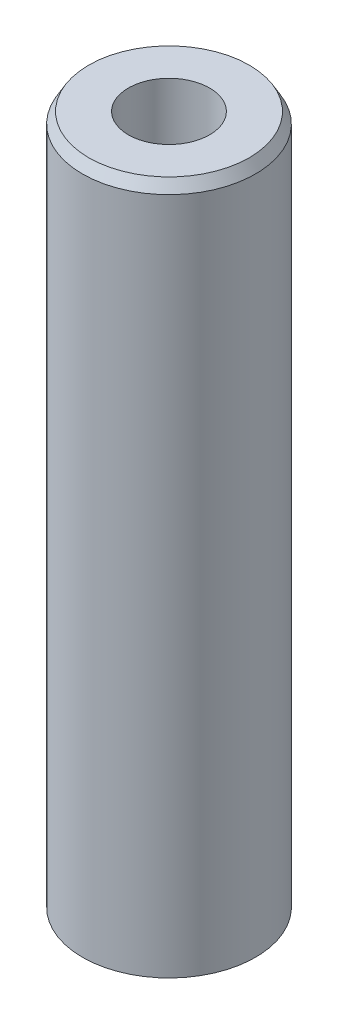
from build123d import *
from OCP.BRepFilletAPI import BRepFilletAPI_MakeChamfer

# Parameters (mm, degrees)
SKETCH1_R           = 12.5
BOSS_EXTRUDE1_DEPTH = 100.452609283
SKETCH2_R           = 5.864717417
CUT_EXTRUDE1_DEPTH  = 102.996209301
CHAMFER1_SIZE       = 1.575601773
CHAMFER1_SIZE2      = 0.909674108


with BuildPart() as part:
    # Sketch1 → Boss-Extrude1 (new body)
    with BuildSketch(Plane(origin=(0, 0, 0), x_dir=(1, 0, 0), z_dir=(0, 1, 0))):
        Circle(SKETCH1_R)
    extrude(amount=BOSS_EXTRUDE1_DEPTH)

    # Sketch2 → Cut-Extrude1 (cut, through all)
    with BuildSketch(Plane(origin=(0, 0, 0), x_dir=(1, 0, 0), z_dir=(0, 1, 0))):
        Circle(SKETCH2_R)
    extrude(amount=CUT_EXTRUDE1_DEPTH, mode=Mode.SUBTRACT)

    # Chamfer1: one chamfer whose edges measure the first distance from different faces: ONE call of the kernel's chamfer builder (chamfer() names one face for all edges)
    chamfer1_edges_1 = [part.edges().sort_by_distance(p)[0] for p in [
        (-12.5, 100.452609283, 0),
    ]]
    chamfer1_side_1 = [part.faces().sort_by_distance(p)[0] for p in [
        (-12.5, 50.226304642, 0),
    ]]
    chamfer1_edges_2 = [part.edges().sort_by_distance(p)[0] for p in [
        (-12.5, 0, 0),
    ]]
    chamfer1_side_2 = [part.faces().sort_by_distance(p)[0] for p in [
        (-12.146446609, 0, 0),
    ]]
    chamfer1 = BRepFilletAPI_MakeChamfer(part.part.solid().wrapped)
    for e in chamfer1_edges_1:
        chamfer1.Add(CHAMFER1_SIZE, CHAMFER1_SIZE2, e.wrapped, chamfer1_side_1[0].wrapped)  # the first distance lies on this face
    for e in chamfer1_edges_2:
        chamfer1.Add(CHAMFER1_SIZE, CHAMFER1_SIZE2, e.wrapped, chamfer1_side_2[0].wrapped)  # the first distance lies on this face
    add(Compound.cast(chamfer1.Shape()), mode=Mode.REPLACE)


solid = part.part
